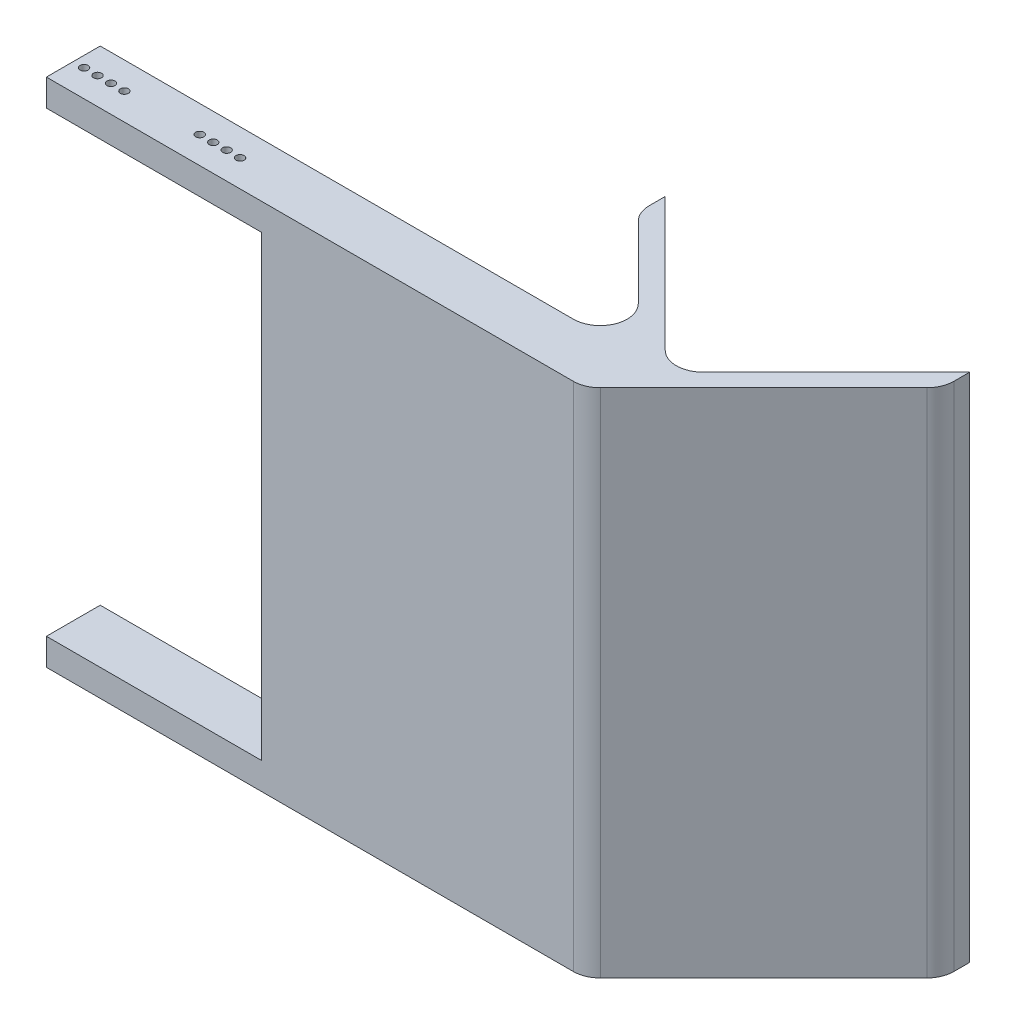
from build123d import *

# Parameters (mm, degrees)
BOSS_EXTRUDE3_DEPTH     = 95
FILLET7_R               = 5
FILLET8_R               = 5
FILLET9_R               = 5
FILLET10_R              = 5
ESQUISSE3_W             = 30
ESQUISSE3_H             = 85
ENL_V_MAT_EXTRU_1_DEPTH = 125.298028947
ESQUISSE5_W             = 10
ESQUISSE5_H             = 60
ENL_V_MAT_EXTRU_2_DEPTH = 125.298028947
ESQUISSE13_R            = 0.75
ENL_V_MAT_EXTRU_3_DEPTH = 10
ESQUISSE4_R             = 0.75
ENL_V_MAT_EXTRU_6_DEPTH = 10
ESQUISSE14_W            = 10
ESQUISSE14_H            = 25
ENL_V_MAT_EXTRU_7_DEPTH = 125.298028947


with BuildPart() as part:
    # Sketch1 → Boss-Extrude3 (new body)
    with BuildSketch(Plane(origin=(0, 0, 0), x_dir=(1, 0, 0), z_dir=(0, 1, 0))):
        Polygon((-75, 0), (-75, 10), (25, 10), (1.715728753, 33.284271247), (1.715728753, 38.284271247), (30, 10), (58.284271247, 38.284271247), (58.284271247, 33.284271247), (35, 10), (25, 0), align=None)
    extrude(amount=BOSS_EXTRUDE3_DEPTH)

    # Fillet7
    fillet7_edges = [part.edges().sort_by_distance(p)[0] for p in [
        (30, 47.5, -10),
    ]]
    fillet(fillet7_edges, radius=FILLET7_R)

    # Fillet8
    fillet8_edges = [part.edges().sort_by_distance(p)[0] for p in [
        (25, 47.5, -10),
    ]]
    fillet(fillet8_edges, radius=FILLET8_R)

    # Fillet9
    fillet9_edges = [part.edges().sort_by_distance(p)[0] for p in [
        (58.284271247, 47.5, -33.284271247),
        (1.715728753, 47.5, -33.284271247),
    ]]
    fillet(fillet9_edges, radius=FILLET9_R)

    # Fillet10
    fillet10_edges = [part.edges().sort_by_distance(p)[0] for p in [
        (25, 47.5, 0),
    ]]
    fillet(fillet10_edges, radius=FILLET10_R)

    # Esquisse3 → Enlèv. mat.-Extru.1 (cut, through all)
    with BuildSketch(Plane(origin=(0, 0, -10), x_dir=(-1, 0, 0), z_dir=(0, 0, -1))):
        with Locations((60, 47.5)):
            Rectangle(ESQUISSE3_W, ESQUISSE3_H)
    extrude(amount=-ENL_V_MAT_EXTRU_1_DEPTH, mode=Mode.SUBTRACT)

    # Esquisse5 → Enlèv. mat.-Extru.2 (cut, through all)
    with BuildSketch(Plane(origin=(0, 0, -10), x_dir=(-1, 0, 0), z_dir=(0, 0, -1))):
        with Locations((40, 35)):
            Rectangle(ESQUISSE5_W, ESQUISSE5_H)
    extrude(amount=-ENL_V_MAT_EXTRU_2_DEPTH, mode=Mode.SUBTRACT)

    # Esquisse13 → Enlèv. mat.-Extru.3 (cut)
    with BuildSketch(Plane(origin=(0, 90, 0), x_dir=(-1, 0, 0), z_dir=(0, -1, 0))):
        with Locations((44, 5)):
            Circle(ESQUISSE13_R)
    extrude(amount=-ENL_V_MAT_EXTRU_3_DEPTH, mode=Mode.SUBTRACT)

    # Esquisse4 → Enlèv. mat.-Extru.6 (cut)
    with BuildSketch(Plane.XZ.offset(-90)):
        with Locations((-73, -5)):
            Circle(ESQUISSE4_R)
        with Locations((-68, -5)):
            Circle(ESQUISSE4_R)
        with Locations((-70.5, -5)):
            Circle(ESQUISSE4_R)
        with Locations((-65.5, -5)):
            Circle(ESQUISSE4_R)
        with Locations((-46.5, -5)):
            Circle(ESQUISSE4_R)
        with Locations((-49, -5)):
            Circle(ESQUISSE4_R)
        with Locations((-51.5, -5)):
            Circle(ESQUISSE4_R)
    extrude(amount=-ENL_V_MAT_EXTRU_6_DEPTH, mode=Mode.SUBTRACT)

    # Esquisse14 → Enlèv. mat.-Extru.7 (cut, through all)
    with BuildSketch(Plane(origin=(0, 0, -10), x_dir=(-1, 0, 0), z_dir=(0, 0, -1))):
        with Locations((40, 77.5)):
            Rectangle(ESQUISSE14_W, ESQUISSE14_H)
    extrude(amount=-ENL_V_MAT_EXTRU_7_DEPTH, mode=Mode.SUBTRACT)


solid = part.part
